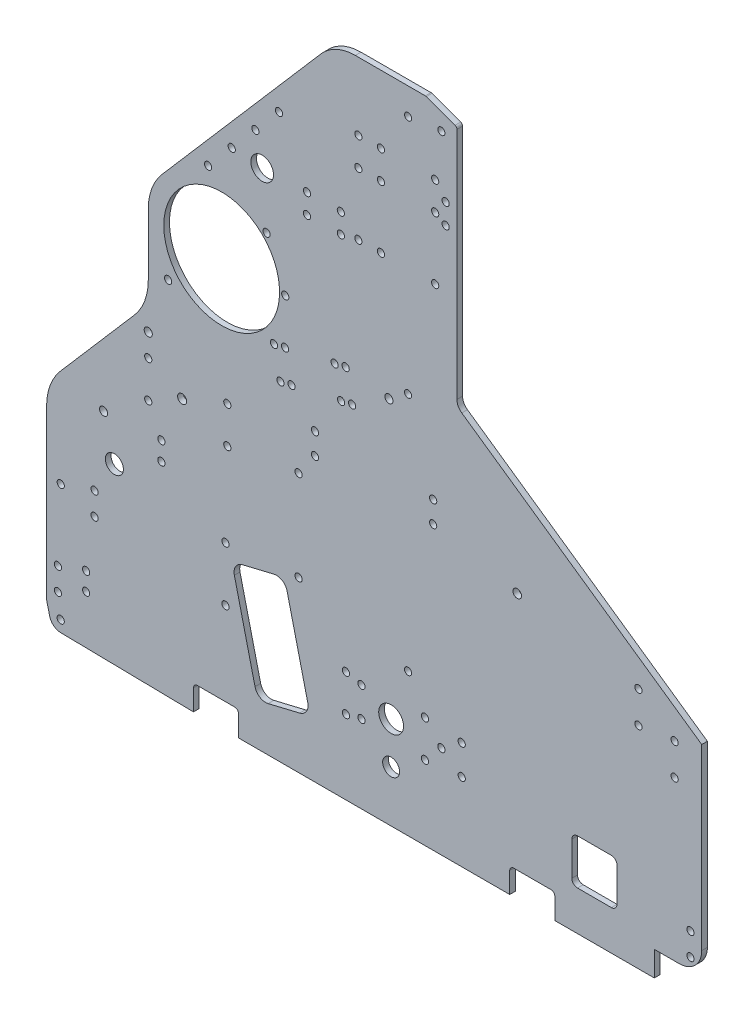
from build123d import *

# Parameters (mm, degrees)
SKETCH1_R           = 2.032
SKETCH1_R_2         = 5.08
SKETCH1_R_3         = 2.54
SKETCH1_R_4         = 2
BOSS_EXTRUDE1_DEPTH = 3.175
FILLET1_R           = 2.286
FILLET2_R           = 6.35
SKETCH2_R           = 2.032
CUT_EXTRUDE1_DEPTH  = 505.524983177
FILLET3_R           = 1.5875
SKETCH3_R           = 2.032
SKETCH3_R_2         = 2.286
CUT_EXTRUDE2_DEPTH  = 505.524983177
SKETCH4_R           = 2.032
SKETCH4_R_2         = 6.985
SKETCH4_R_3         = 4.7625
CUT_EXTRUDE3_DEPTH  = 505.524983177
SKETCH5_R           = 32.54375
SKETCH5_R_2         = 2.39
SKETCH5_W           = 29.448186139
SKETCH5_H           = 14.946422423
CUT_EXTRUDE5_DEPTH  = 505.524983177
FILLET4_R           = 31.75
CUT_EXTRUDE6_DEPTH  = 505.524983177
FILLET5_R           = 25.4
SKETCH8_R           = 2.032000002
SKETCH8_R_2         = 2.031999999
SKETCH8_R_3         = 2.031999998
CUT_EXTRUDE7_DEPTH  = 505.524983177
SKETCH10_R          = 2.032
CUT_EXTRUDE8_DEPTH  = 505.524983177
SKETCH11_RX         = 2.032
SKETCH11_RY         = 2.031999502
CUT_EXTRUDE9_DEPTH  = 505.524983177
SKETCH12_R          = 2.032
CUT_EXTRUDE10_DEPTH = 505.524983319
SKETCH14_R          = 6.375981846
CUT_EXTRUDE11_DEPTH = 505.524983319
SKETCH15_R          = 2.286
CUT_EXTRUDE12_DEPTH = 505.524983319
FILLET6_R           = 12.7


with BuildPart() as part:
    # Sketch1 → Boss-Extrude1 (new body)
    with BuildSketch(Plane.XY):
        with BuildLine():
            Line((7.829508682, -19.049081656), (82.55, -20.32))
            Line((82.55, -20.32), (82.55, -6.35))
            Line((82.55, -6.35), (107.95, -6.35))
            Line((107.95, -6.35), (107.95, -20.32))
            Line((107.95, -20.32), (260.35, -20.32))
            Line((260.35, -20.32), (260.35, -6.35))
            Line((260.35, -6.35), (285.75, -6.35))
            Line((285.75, -6.35), (285.75, -20.32))
            Line((285.75, -20.32), (368.3, -20.32))
            Line((368.3, -20.32), (368.3, 106.68))
            Line((368.3, 106.68), (230.66375, 202.565))
            Line((230.66375, 202.565), (230.66375, 338.455))
            Line((230.66375, 338.455), (213.19998, 344.805))
            Line((213.19998, 344.805), (203.2, 344.805))
            Line((203.2, 344.805), (161.925, 344.805))
            Line((161.925, 344.805), (52.720122664, 218.469945827))
            ThreePointArc((52.720122664, 218.469945827), (52.803835479, 218.142145922), (52.832, 217.805))
            ThreePointArc((52.832, 217.805), (52.095493096, 216.239521914), (50.419872403, 215.808871996))
            Line((50.419872403, 215.808871996), (0, 157.48))
            Line((0, 157.48), (0, 0))
            Line((0, 0), (0, -6.35))
            ThreePointArc((0, -6.35), (0.047577015, -7.125863724), (0.189595124, -7.890101219))
            Line((0.189595124, -7.890101219), (1.777095124, -14.240101219))
            ThreePointArc((1.777095124, -14.240101219), (3.987212552, -17.671692778), (7.829508682, -19.049081656))
        make_face()
        with Locations((7.9375, -12.7)):
            Circle(SKETCH1_R, mode=Mode.SUBTRACT)
        with Locations((6.35, 0)):
            Circle(SKETCH1_R, mode=Mode.SUBTRACT)
        with Locations((6.35, 12.7)):
            Circle(SKETCH1_R, mode=Mode.SUBTRACT)
        with Locations((38.1, 78.105)):
            Circle(SKETCH1_R_2, mode=Mode.SUBTRACT)
        with Locations((57.15, 118.58625)):
            Circle(SKETCH1_R, mode=Mode.SUBTRACT)
        with Locations((57.15, 139.22375)):
            Circle(SKETCH1_R, mode=Mode.SUBTRACT)
        with Locations((76.2, 128.905)):
            Circle(SKETCH1_R_3, mode=Mode.SUBTRACT)
        with Locations((101.6, 118.58625)):
            Circle(SKETCH1_R, mode=Mode.SUBTRACT)
        with Locations((101.6, 139.22375)):
            Circle(SKETCH1_R, mode=Mode.SUBTRACT)
        with Locations((203.2, 59.805)):
            Circle(SKETCH1_R_4, mode=Mode.SUBTRACT)
        with Locations((361.95, 0)):
            Circle(SKETCH1_R, mode=Mode.SUBTRACT)
        with Locations((361.95, 12.7)):
            Circle(SKETCH1_R, mode=Mode.SUBTRACT)
        with Locations((353.06, 82.955052336)):
            Circle(SKETCH1_R, mode=Mode.SUBTRACT)
        with Locations((332.74, 98.195052336)):
            Circle(SKETCH1_R, mode=Mode.SUBTRACT)
        with Locations((332.74, 115.975052336)):
            Circle(SKETCH1_R, mode=Mode.SUBTRACT)
        with Locations((353.06, 100.735052336)):
            Circle(SKETCH1_R, mode=Mode.SUBTRACT)
        with Locations((68.326, 182.923674932)):
            Circle(SKETCH1_R, mode=Mode.SUBTRACT)
        with Locations((76.2, 217.805)):
            Circle(SKETCH1_R, mode=Mode.SUBTRACT)
        with Locations((90.779500502, 249.682)):
            Circle(SKETCH1_R, mode=Mode.SUBTRACT)
        with Locations((104.067838673, 265.054783374)):
            Circle(SKETCH1_R, mode=Mode.SUBTRACT)
        with Locations((117.356176844, 280.427566748)):
            Circle(SKETCH1_R, mode=Mode.SUBTRACT)
        with Locations((130.644515014, 295.800350122)):
            Circle(SKETCH1_R, mode=Mode.SUBTRACT)
        with Locations((203.2, 194.805)):
            Circle(SKETCH1_R_4, mode=Mode.SUBTRACT)
        with Locations((224.31375, 287.401)):
            Circle(SKETCH1_R, mode=Mode.SUBTRACT)
        with Locations((224.31375, 298.831)):
            Circle(SKETCH1_R, mode=Mode.SUBTRACT)
        with Locations((203.2, 329.805)):
            Circle(SKETCH1_R_4, mode=Mode.SUBTRACT)
        with Locations((221.931865, 332.105)):
            Circle(SKETCH1_R_4, mode=Mode.SUBTRACT)
    extrude(amount=BOSS_EXTRUDE1_DEPTH)

    # Fillet1
    fillet1_edges = [part.edges().sort_by_distance(p)[0] for p in [
        (285.75, -6.35, 1.5875),
        (107.95, -6.35, 1.5875),
        (260.35, -6.35, 1.5875),
        (82.55, -6.35, 1.5875),
    ]]
    fillet(fillet1_edges, radius=FILLET1_R)

    # Fillet2
    fillet2_edges = [part.edges().sort_by_distance(p)[0] for p in [
        (230.66375, 202.565, 1.5875),
    ]]
    fillet(fillet2_edges, radius=FILLET2_R)

    # Sketch2 → Cut-Extrude1 (cut, through all)
    with BuildSketch(Plane(origin=(0, 0, 0), x_dir=(-1, 0, 0), z_dir=(0, 0, -1))):
        with Locations((-100.552770272, 71.086035298)):
            Circle(SKETCH2_R)
        with Locations((-100.552770272, 40.606035298)):
            Circle(SKETCH2_R)
        with Locations((-22.225, 18.202541089)):
            Circle(SKETCH2_R)
        with Locations((-22.225, 8.042541089)):
            Circle(SKETCH2_R)
    extrude(amount=-CUT_EXTRUDE1_DEPTH, mode=Mode.SUBTRACT)

    # Fillet3
    fillet3_edges = [part.edges().sort_by_distance(p)[0] for p in [
        (230.66375, 338.455, 1.5875),
        (213.19998, 344.805, 1.5875),
    ]]
    fillet(fillet3_edges, radius=FILLET3_R)

    # Sketch3 → Cut-Extrude2 (cut, through all)
    with BuildSketch(Plane.XY.offset(3.175)):
        with BuildLine():
            Line((127.789350211, 69.359774106), (110.090750339, 65.117184968))
            ThreePointArc((110.090750339, 65.117184968), (106.287939856, 62.356288953), (105.55119507, 57.715047577))
            Line((105.55119507, 57.715047577), (117.160037875, 9.287010566))
            ThreePointArc((117.160037875, 9.287010566), (119.92093389, 5.484200083), (124.562175266, 4.747455297))
            Line((124.562175266, 4.747455297), (142.260775137, 8.990044434))
            ThreePointArc((142.260775137, 8.990044434), (146.063585621, 11.75094045), (146.800330407, 16.392181825))
            Line((146.800330407, 16.392181825), (135.191487602, 64.820218836))
            ThreePointArc((135.191487602, 64.820218836), (132.430591586, 68.62302932), (127.789350211, 69.359774106))
        make_face()
        with Locations((26.987500002, 46.953113935)):
            Circle(SKETCH3_R)
        with Locations((26.987500002, 59.653113935)):
            Circle(SKETCH3_R)
        with Locations((7.937500002, 53.303113935)):
            Circle(SKETCH3_R)
        with Locations((32.030600738, 100.810868776)):
            Circle(SKETCH3_R_2)
        with Locations((64.525942114, 102.94048958)):
            Circle(SKETCH3_R)
        with Locations((64.525942114, 92.525786339)):
            Circle(SKETCH3_R)
        with Locations((134.14375, 208.228121768)):
            Circle(SKETCH3_R)
        with Locations((123.681970341, 233.485092108)):
            Circle(SKETCH3_R)
    extrude(amount=-CUT_EXTRUDE2_DEPTH, mode=Mode.SUBTRACT)

    # Sketch4 → Cut-Extrude3 (cut, through all)
    with BuildSketch(Plane.XY.offset(3.175)):
        with Locations((168.275, 42.06875)):
            Circle(SKETCH4_R)
        with Locations((212.725, 42.06875)):
            Circle(SKETCH4_R)
        with Locations((212.725, 21.43125)):
            Circle(SKETCH4_R)
        with Locations((168.275, 21.43125)):
            Circle(SKETCH4_R)
        with Locations((193.675, 31.75)):
            Circle(SKETCH4_R_2)
        with Locations((177.00498, 40.0431)):
            Circle(SKETCH4_R)
        with Locations((177.00498, 23.4569)):
            Circle(SKETCH4_R)
        with Locations((193.675, 8.466666658)):
            Circle(SKETCH4_R_3)
        with Locations((221.931865, 31.75)):
            Circle(SKETCH4_R)
        with Locations((233.36123, 23.4569)):
            Circle(SKETCH4_R)
        with Locations((233.36123, 40.0431)):
            Circle(SKETCH4_R)
    extrude(amount=-CUT_EXTRUDE3_DEPTH, mode=Mode.SUBTRACT)

    # Sketch5 → Cut-Extrude5 (cut, through all)
    with BuildSketch(Plane(origin=(0, 0, 0), x_dir=(-1, 0, 0), z_dir=(0, 0, -1))):
        with Locations((-98.425, 208.228121768)):
            Circle(SKETCH5_R)
        Polygon((0, 157.48), (0, 99.218990229), (-57.15, 165.333696112), (-57.15, 223.594705882), align=None)
        with Locations((-264.573581764, 128.332790468)):
            Circle(SKETCH5_R_2)
        with Locations((-356.354093068, -13.823211213)):
            Rectangle(SKETCH5_W, SKETCH5_H)
    extrude(amount=-CUT_EXTRUDE5_DEPTH, mode=Mode.SUBTRACT)

    # Fillet4
    fillet4_edges = [part.edges().sort_by_distance(p)[0] for p in [
        (0, 99.218990229, 1.5875),
        (57.15, 165.333696112, 1.5875),
        (57.15, 223.594705882, 1.5875),
    ]]
    fillet(fillet4_edges, radius=FILLET4_R)

    # Sketch6 → Cut-Extrude6 (cut, through all)
    with BuildSketch(Plane.XY.offset(3.175)):
        with BuildLine():
            Line((298.45, 27.305), (317.5, 27.305))
            ThreePointArc((317.5, 27.305), (319.74506403, 26.37506403), (320.675, 24.13))
            Line((320.675, 24.13), (320.675, 5.08))
            ThreePointArc((320.675, 5.08), (319.74506403, 2.83493597), (317.5, 1.905))
            Line((317.5, 1.905), (298.45, 1.905))
            ThreePointArc((298.45, 1.905), (296.20493597, 2.83493597), (295.275, 5.08))
            Line((295.275, 5.08), (295.275, 24.13))
            ThreePointArc((295.275, 24.13), (296.20493597, 26.37506403), (298.45, 27.305))
        make_face()
    extrude(amount=-CUT_EXTRUDE6_DEPTH, mode=Mode.SUBTRACT)

    # Fillet5
    fillet5_edges = [part.edges().sort_by_distance(p)[0] for p in [
        (161.925, 344.805, 1.5875),
    ]]
    fillet(fillet5_edges, radius=FILLET5_R)

    # Sketch8 → Cut-Extrude7 (cut, through all)
    with BuildSketch(Plane(origin=(0, 0, 0), x_dir=(-1, 0, 0), z_dir=(0, 0, -1))):
        with Locations((-218.44, 290.83)):
            Circle(SKETCH8_R)
        with Locations((-187.96, 290.83)):
            Circle(SKETCH8_R)
        with Locations((-187.96, 306.70500001)):
            Circle(SKETCH8_R_2)
        with Locations((-175.26, 290.83)):
            Circle(SKETCH8_R)
        with Locations((-187.96, 255.905)):
            Circle(SKETCH8_R)
        with Locations((-218.44, 306.70500001)):
            Circle(SKETCH8_R_3)
        with Locations((-175.26, 306.70500001)):
            Circle(SKETCH8_R_2)
        with Locations((-175.26, 255.905)):
            Circle(SKETCH8_R)
        with Locations((-218.44, 255.905)):
            Circle(SKETCH8_R)
    extrude(amount=-CUT_EXTRUDE7_DEPTH, mode=Mode.SUBTRACT)

    # Sketch10 → Cut-Extrude8 (cut, through all)
    with BuildSketch(Plane.XY.offset(3.175)):
        with Locations((141.64248, 74.684371768)):
            Circle(SKETCH10_R)
        with Locations((141.64248, 125.484371768)):
            Circle(SKETCH10_R)
    extrude(amount=-CUT_EXTRUDE8_DEPTH, mode=Mode.SUBTRACT)

    # Sketch11 → Cut-Extrude9 (cut, through all)
    with BuildSketch(Plane.XY.offset(3.175)):
        with Locations(Location((150.881424454, 138.43), (0, 0, 90))):
            Ellipse(SKETCH11_RX, SKETCH11_RY)
        with Locations(Location((150.881424454, 150.495), (0, 0, 90))):
            Ellipse(SKETCH11_RX, SKETCH11_RY)
        with Locations(Location((217.30240818, 150.495), (0, 0, 90))):
            Ellipse(SKETCH11_RX, SKETCH11_RY)
        with Locations(Location((217.30240818, 138.43), (0, 0, 90))):
            Ellipse(SKETCH11_RX, SKETCH11_RY)
    extrude(amount=-CUT_EXTRUDE9_DEPTH, mode=Mode.SUBTRACT)

    # Sketch12 → Cut-Extrude10 (cut, through all)
    with BuildSketch(Plane(origin=(0, 0, 0), x_dir=(-1, 0, 0), z_dir=(0, 0, -1))):
        with Locations((-165.4175, 264.63498)):
            Circle(SKETCH12_R)
        with Locations((-165.4175, 253.52248)):
            Circle(SKETCH12_R)
        with Locations((-146.3675, 253.52248)):
            Circle(SKETCH12_R)
        with Locations((-146.3675, 264.63498)):
            Circle(SKETCH12_R)
    extrude(amount=-CUT_EXTRUDE10_DEPTH, mode=Mode.SUBTRACT)

    # Sketch14 → Cut-Extrude11 (cut, through all)
    with BuildSketch(Plane(origin=(0, 0, 0), x_dir=(-1, 0, 0), z_dir=(0, 0, -1))):
        with Locations((-121.184716432, 263.688494682)):
            Circle(SKETCH14_R)
    extrude(amount=-CUT_EXTRUDE11_DEPTH, mode=Mode.SUBTRACT)

    # Sketch15 → Cut-Extrude12 (cut, through all)
    with BuildSketch(Plane.XY.offset(3.175)):
        with Locations((57.15, 151.92375)):
            Circle(SKETCH15_R)
        with Locations((192.439038956, 187.119947783)):
            Circle(SKETCH15_R)
        with BuildLine():
            ThreePointArc((163.873739892, 173.680575348), (163.573171662, 172.102507308), (164.512499361, 170.799317578))
            ThreePointArc((164.512499361, 170.799317578), (167.540838635, 172.982117899), (163.873739892, 173.680575348))
        make_face()
        with BuildLine():
            ThreePointArc((173.43975005, 172.778441408), (173.74031828, 174.356509448), (172.800990581, 175.659699178))
            ThreePointArc((172.800990581, 175.659699178), (169.772651307, 173.476898857), (173.43975005, 172.778441408))
        make_face()
        with BuildLine():
            ThreePointArc((169.158852977, 192.088320238), (166.130513704, 189.905519916), (169.797612447, 189.207062467))
            ThreePointArc((169.797612447, 189.207062467), (170.098180676, 190.785130507), (169.158852977, 192.088320238))
        make_face()
        with BuildLine():
            ThreePointArc((160.231602288, 190.109196408), (159.931034058, 188.531128368), (160.870361758, 187.227938637))
            ThreePointArc((160.870361758, 187.227938637), (163.898701031, 189.410738959), (160.231602288, 190.109196408))
        make_face()
        with BuildLine():
            ThreePointArc((129.776601843, 166.121421831), (129.476033613, 164.543353791), (130.415361312, 163.240164061))
            ThreePointArc((130.415361312, 163.240164061), (133.443700586, 165.422964382), (129.776601843, 166.121421831))
        make_face()
        with BuildLine():
            ThreePointArc((139.342612002, 165.219287891), (139.643180231, 166.797355931), (138.703852532, 168.100545661))
            ThreePointArc((138.703852532, 168.100545661), (135.675513258, 165.91774534), (139.342612002, 165.219287891))
        make_face()
        with BuildLine():
            ThreePointArc((135.700474398, 181.647908951), (136.001042628, 183.225976991), (135.061714929, 184.529166721))
            ThreePointArc((135.061714929, 184.529166721), (132.033375655, 182.3463664), (135.700474398, 181.647908951))
        make_face()
        with BuildLine():
            ThreePointArc((126.134464239, 182.550042891), (125.83389601, 180.971974851), (126.773223709, 179.668785121))
            ThreePointArc((126.773223709, 179.668785121), (129.801562983, 181.851585442), (126.134464239, 182.550042891))
        make_face()
    extrude(amount=-CUT_EXTRUDE12_DEPTH, mode=Mode.SUBTRACT)

    # Fillet6
    fillet6_edges = [part.edges().sort_by_distance(p)[0] for p in [
        (368.3, -6.350000001, 1.5875),
    ]]
    fillet(fillet6_edges, radius=FILLET6_R)


solid = part.part
